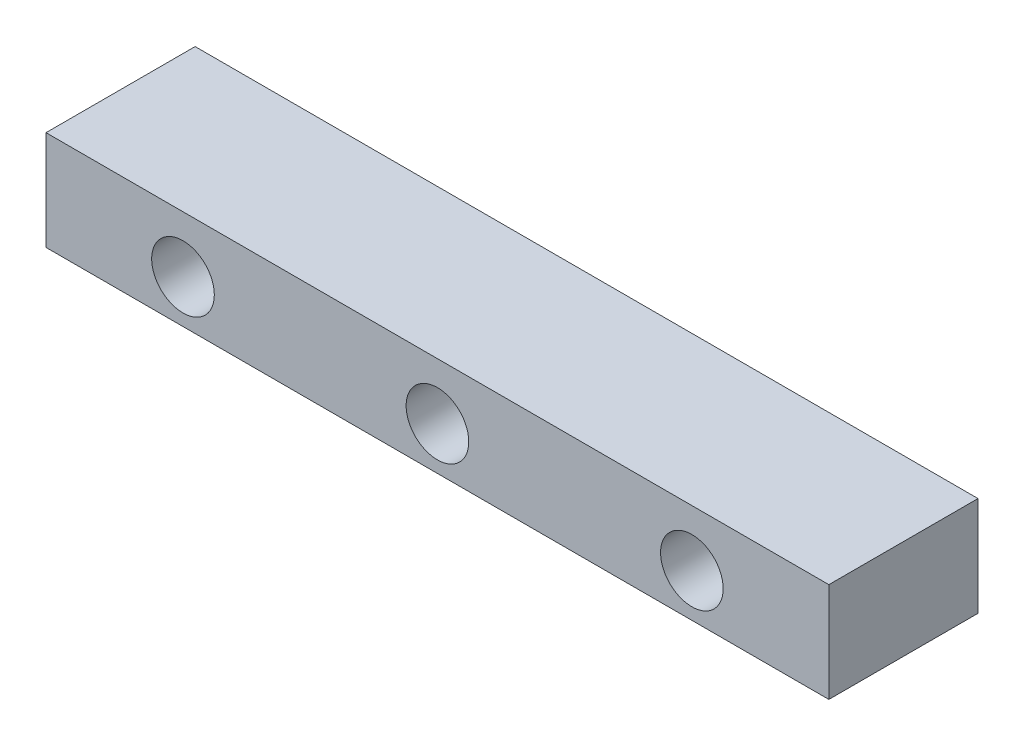
from build123d import *

# Parameters (mm, degrees)
SKETCH1_W           = 400
SKETCH1_H           = 76.2
BOSS_EXTRUDE1_DEPTH = 50.8
SKETCH2_R           = 16
CUT_EXTRUDE1_DEPTH  = 76.2


with BuildPart() as part:
    # Sketch1 → Boss-Extrude1 (new body)
    with BuildSketch(Plane(origin=(0, 0, 0), x_dir=(1, 0, 0), z_dir=(0, 1, 0))):
        with Locations((200, 38.1)):
            Rectangle(SKETCH1_W, SKETCH1_H)
    extrude(amount=BOSS_EXTRUDE1_DEPTH)

    # Sketch2 → Cut-Extrude1 (cut)
    with BuildSketch(Plane.XY):
        with Locations((70, 22)):
            Circle(SKETCH2_R)
        with Locations((200, 22)):
            Circle(SKETCH2_R)
        with Locations((330, 22)):
            Circle(SKETCH2_R)
    extrude(amount=-CUT_EXTRUDE1_DEPTH, mode=Mode.SUBTRACT)


solid = part.part
